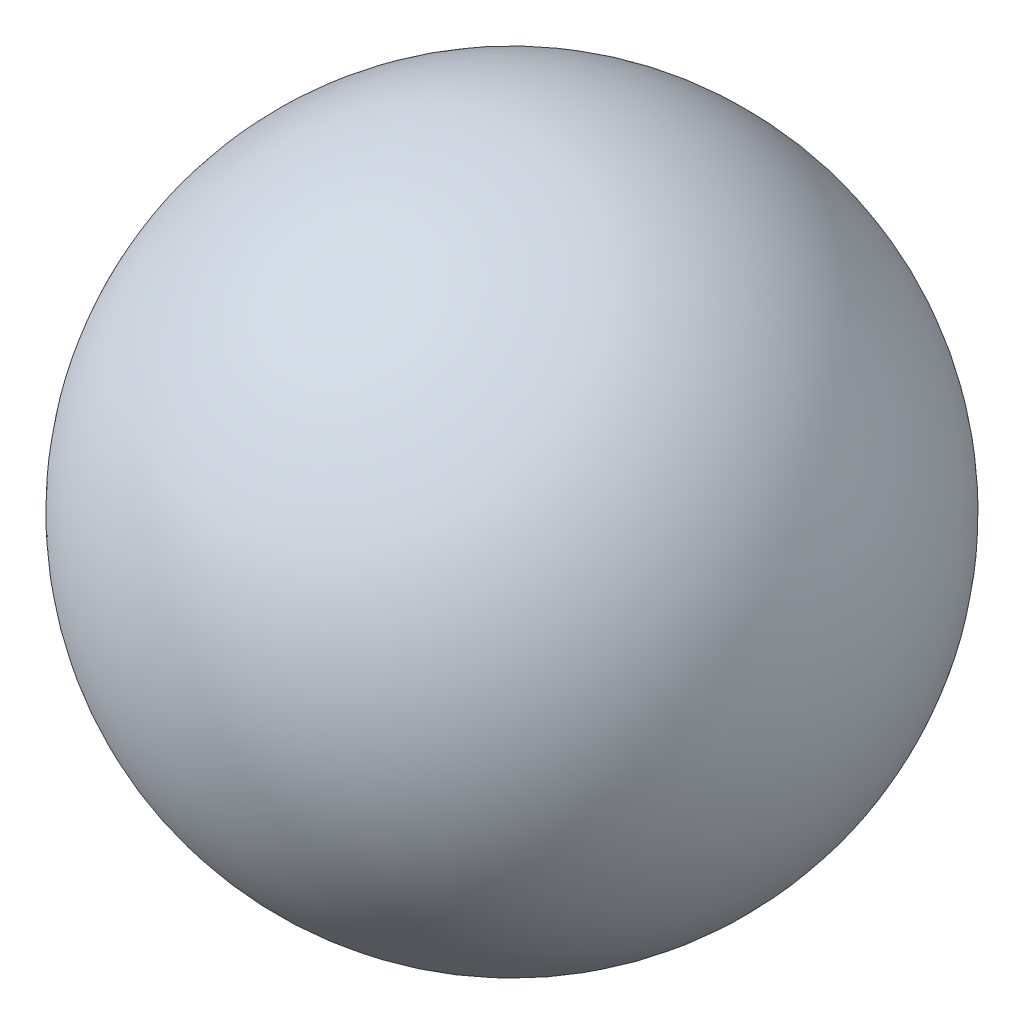
from build123d import *


with BuildPart() as part:
    # 草图1 → 旋转3 (revolve)
    with BuildSketch(Plane.XY):
        with BuildLine():
            Line((-4.5, 0), (4.5, 0))
            ThreePointArc((4.5, 0), (0, 4.5), (-4.5, 0))
        make_face()
    revolve(axis=Axis((-6.174343037, 0, 0), (1, 0, 0)))


solid = part.part
